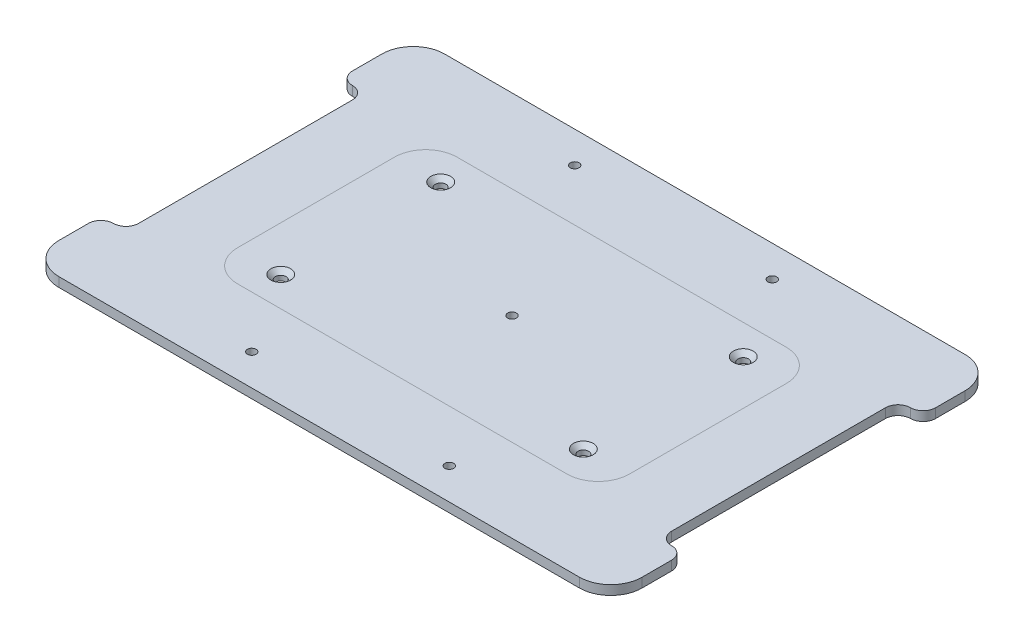
from build123d import *

# Parameters (mm, degrees)
BOSS_EXTRUDE1_DEPTH                            = 3
CSK_FOR_M3_FLAT_HEAD_MACHINE_SCREW1_AT_2_COUNT = 2
CSK_FOR_M3_FLAT_HEAD_MACHINE_SCREW1_AT_2_PITCH = 96.5
CSK_FOR_M3_FLAT_HEAD_MACHINE_SCREW1_AT_3_COUNT = 2
CSK_FOR_M3_FLAT_HEAD_MACHINE_SCREW1_AT_3_PITCH = 109.147835526
CSK_FOR_M3_FLAT_HEAD_MACHINE_SCREW1_AT_4_COUNT = 2
CSK_FOR_M3_FLAT_HEAD_MACHINE_SCREW1_AT_4_PITCH = 51
F_3_CLEARANCE_HOLE2_D                          = 2.794
FILLET1_R                                      = 10
FILLET2_START                                  = -1
FILLET2_DEPTH                                  = 5
FILLET2_2_DEPTH                                = 3
SPLIT2_SURFACE_1_BACK                          = 224.011
SPLIT2_SURFACE_1_DEPTH                         = 448.022
SPLIT2_SURFACE_2_BACK                          = 224.011
SPLIT2_SURFACE_2_DEPTH                         = 448.022


with BuildPart() as part:
    # Boss-Extrude1: read off the stored shape, not the designer's step
    # Boss-Extrude1 outline → Boss-Extrude1 (new body)
    with BuildSketch(Plane(origin=(0, 0, 0), x_dir=(1, 0, 0), z_dir=(0, 1, 0))):
        Polygon((-93, -38.1), (-93, -61.5), (93, -61.5), (93, -38.1), (85, -38.1), (85, 38.1), (93, 38.1), (93, 61.5), (-93, 61.5), (-93, 38.1), (-85, 38.1), (-85, -38.1), align=None)
    extrude(amount=BOSS_EXTRUDE1_DEPTH)

    # Sketch3 → CSK for M3 Flat Head Machine Screw1 (revolve, cut)
    with BuildSketch(Plane(origin=(-48.25, 3, -25.5), x_dir=(0, 0, 1), z_dir=(1, 0, 0))):
        Polygon((0, 0), (0, 3), (1.7, 3), (1.7, 1.45), (3.15, 0), align=None)
    csk_for_m3_flat_head_machine_screw1 = revolve(axis=Axis((-48.25, 9.35, -25.5), (0, -1, 0)), mode=Mode.SUBTRACT)

    # CSK for M3 Flat Head Machine Screw1 at 2: CSK for M3 Flat Head Machine Screw1 ×2
    with Locations(*[(i * CSK_FOR_M3_FLAT_HEAD_MACHINE_SCREW1_AT_2_PITCH, 0, 0) for i in range(1, CSK_FOR_M3_FLAT_HEAD_MACHINE_SCREW1_AT_2_COUNT)]):
        add(csk_for_m3_flat_head_machine_screw1, mode=Mode.SUBTRACT)

    # CSK for M3 Flat Head Machine Screw1 at 3: CSK for M3 Flat Head Machine Screw1 ×2
    with Locations(*[Vector(0.8841219758046083, 0, 0.4672561737412956) * (i * CSK_FOR_M3_FLAT_HEAD_MACHINE_SCREW1_AT_3_PITCH) for i in range(1, CSK_FOR_M3_FLAT_HEAD_MACHINE_SCREW1_AT_3_COUNT)]):
        add(csk_for_m3_flat_head_machine_screw1, mode=Mode.SUBTRACT)

    # CSK for M3 Flat Head Machine Screw1 at 4: CSK for M3 Flat Head Machine Screw1 ×2
    with Locations(*[(0, 0, i * CSK_FOR_M3_FLAT_HEAD_MACHINE_SCREW1_AT_4_PITCH) for i in range(1, CSK_FOR_M3_FLAT_HEAD_MACHINE_SCREW1_AT_4_COUNT)]):
        add(csk_for_m3_flat_head_machine_screw1, mode=Mode.SUBTRACT)

    # #3 Clearance Hole2 (through all)
    with Locations(Plane(origin=(0, 3, 0), x_dir=(1, 0, 0), z_dir=(0, 1, 0))):
        with Locations((-31.5, 51.5), (31.5, 51.5), (31.5, -51.5), (-31.5, -51.5), (0, 0)):
            Hole(F_3_CLEARANCE_HOLE2_D / 2)

    # Fillet1
    fillet1_edges = [part.edges().sort_by_distance(p)[0] for p in [
        (-93, 1.5, -61.5),
        (93, 1.5, -61.5),
        (93, 1.5, 61.5),
        (-93, 1.5, 61.5),
    ]]
    fillet(fillet1_edges, radius=FILLET1_R)

    # Fillet2: read off the stored shape, not the designer's step
    # Fillet2 outline → Fillet2 (cut)
    with BuildSketch(Plane(origin=(0, 0, 0), x_dir=(1, 0, 0), z_dir=(0, 1, 0)).offset(FILLET2_START)):
        with BuildLine():
            Line((-93, 38.1), (-89, 38.1))
            ThreePointArc((-89, 38.1), (-91.828427125, 39.271572875), (-93, 42.1))
            Line((-93, 42.1), (-93, 38.1))
        make_face()
        with BuildLine():
            ThreePointArc((-93, -42.1), (-91.828427125, -39.271572875), (-89, -38.1))
            Line((-89, -38.1), (-93, -38.1))
            Line((-93, -38.1), (-93, -42.1))
        make_face()
        with BuildLine():
            Line((93, -38.1), (89, -38.1))
            ThreePointArc((89, -38.1), (91.828427125, -39.271572875), (93, -42.1))
            Line((93, -42.1), (93, -38.1))
        make_face()
        with BuildLine():
            ThreePointArc((93, 42.1), (91.828427125, 39.271572875), (89, 38.1))
            Line((89, 38.1), (93, 38.1))
            Line((93, 38.1), (93, 42.1))
        make_face()
    extrude(amount=FILLET2_DEPTH, mode=Mode.SUBTRACT)

    # Fillet2 2 outline → Fillet2 2 (add)
    with BuildSketch(Plane(origin=(0, 0, 0), x_dir=(1, 0, 0), z_dir=(0, 1, 0))):
        with BuildLine():
            ThreePointArc((-89, 38.1), (-86.171572875, 36.928427125), (-85, 34.1))
            Line((-85, 34.1), (-85, 38.1))
            Line((-85, 38.1), (-89, 38.1))
        make_face()
        with BuildLine():
            ThreePointArc((-85, -34.1), (-86.171572875, -36.928427125), (-89, -38.1))
            Line((-89, -38.1), (-85, -38.1))
            Line((-85, -38.1), (-85, -34.1))
        make_face()
        with BuildLine():
            ThreePointArc((89, -38.1), (86.171572875, -36.928427125), (85, -34.1))
            Line((85, -34.1), (85, -38.1))
            Line((85, -38.1), (89, -38.1))
        make_face()
        with BuildLine():
            ThreePointArc((85, 34.1), (86.171572875, 36.928427125), (89, 38.1))
            Line((89, 38.1), (85, 38.1))
            Line((85, 38.1), (85, 34.1))
        make_face()
    extrude(amount=FILLET2_2_DEPTH)


with BuildPart() as body_2:
    # Split2: the piece behind the surface
    add(part.part)
    # Split2 surface: a surface, the sketch's curves swept straight by 448.022 mm
    with BuildLine(Plane(origin=(0, 3, 0), x_dir=(1, 0, 0), z_dir=(0, 1, 0)).offset(-SPLIT2_SURFACE_1_BACK), mode=Mode.PRIVATE) as split2_surface_1_path:
        Line((52.5, 35), (-52.5, 35))
        ThreePointArc((-52.5, 35), (-59.571067812, 32.071067812), (-62.5, 25))
        Line((-62.5, 25), (-62.5, -25))
        ThreePointArc((-62.5, -25), (-59.571067812, -32.071067812), (-52.5, -35))
        Line((-52.5, -35), (52.5, -35))
        ThreePointArc((52.5, -35), (59.571067812, -32.071067812), (62.5, -25))
        Line((62.5, -25), (62.5, 25))
        ThreePointArc((62.5, 25), (59.571067812, 32.071067812), (52.5, 35))
    split2_surface_1 = Shell.extrude(split2_surface_1_path.wire(), (0 * SPLIT2_SURFACE_1_DEPTH, 1 * SPLIT2_SURFACE_1_DEPTH, 0 * SPLIT2_SURFACE_1_DEPTH))
    split(bisect_by=split2_surface_1, keep=Keep.BOTTOM)


with BuildPart() as part_1:
    add(part.part)

    # Split2: split by a surface, the side it looks to stays
    # Split2 surface: a surface, the sketch's curves swept straight by 448.022 mm
    with BuildLine(Plane(origin=(0, 3, 0), x_dir=(1, 0, 0), z_dir=(0, 1, 0)).offset(-SPLIT2_SURFACE_2_BACK), mode=Mode.PRIVATE) as split2_surface_2_path:
        Line((52.5, 35), (-52.5, 35))
        ThreePointArc((-52.5, 35), (-59.571067812, 32.071067812), (-62.5, 25))
        Line((-62.5, 25), (-62.5, -25))
        ThreePointArc((-62.5, -25), (-59.571067812, -32.071067812), (-52.5, -35))
        Line((-52.5, -35), (52.5, -35))
        ThreePointArc((52.5, -35), (59.571067812, -32.071067812), (62.5, -25))
        Line((62.5, -25), (62.5, 25))
        ThreePointArc((62.5, 25), (59.571067812, 32.071067812), (52.5, 35))
    split2_surface_2 = Shell.extrude(split2_surface_2_path.wire(), (0 * SPLIT2_SURFACE_2_DEPTH, 1 * SPLIT2_SURFACE_2_DEPTH, 0 * SPLIT2_SURFACE_2_DEPTH))
    split(bisect_by=split2_surface_2, keep=Keep.TOP)


solid = Compound([body_2.part, part_1.part])
